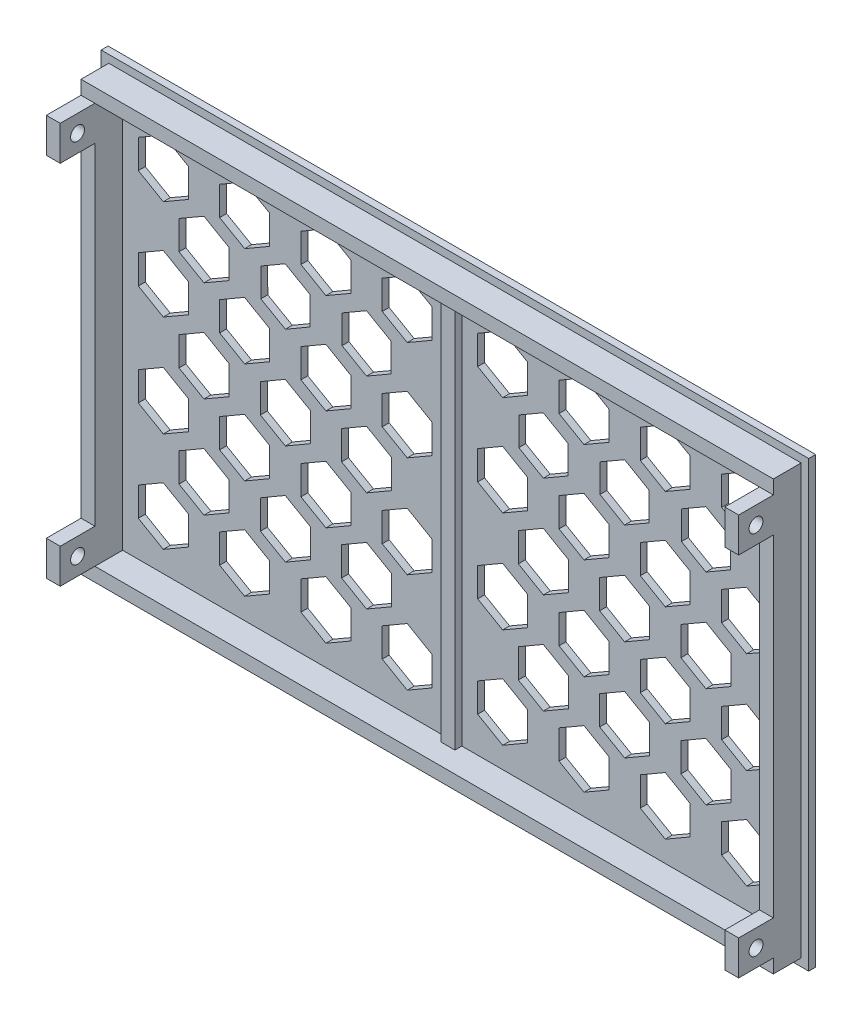
from build123d import *

# Parameters (mm, degrees)
SKETCH_1_W               = 102
SKETCH_1_H               = 64
EXTRUDE_1_DEPTH          = 1
SKETCH_1_4_W             = 99.8
SKETCH_1_4_H             = 2
SKETCH_1_4_W_2           = 2
SKETCH_1_4_H_2           = 47.8
EXTRUDE_3_DEPTH          = 5
SKETCH_1_5_W             = 2
SKETCH_1_5_H             = 5
EXTRUDE_4_DEPTH          = 10
SKETCH_1_7_W             = 2
SKETCH_1_7_H             = 57.8
EXTRUDE_5_DEPTH          = 2
CUT_EXTRUDE_3_DEPTH      = 1
CUT_EXTRUDE_3_DEPTH_BACK = 1
SKETCH_2_R               = 1
CUT_EXTRUDE_4_DEPTH      = 100


with BuildPart() as part:
    # Эскиз1 → Бобышка-Вытянуть1 (new body)
    with BuildSketch(Plane.XY):
        with Locations((9.976998146, -11.748794104)):
            Rectangle(SKETCH_1_W, SKETCH_1_H)
    extrude(amount=EXTRUDE_1_DEPTH)

    # Эскиз1<4> → Бобышка-Вытянуть3 (add)
    with BuildSketch(Plane.XY):
        with Locations((9.976998146, -41.648794104)):
            Rectangle(SKETCH_1_4_W, SKETCH_1_4_H)
        with Locations((-38.923001854, -11.748794104)):
            Rectangle(SKETCH_1_4_W_2, SKETCH_1_4_H_2)
        with Locations((58.876998146, -11.748794104)):
            Rectangle(SKETCH_1_4_W_2, SKETCH_1_4_H_2)
        with Locations((9.976998146, 18.151205896)):
            Rectangle(SKETCH_1_4_W, SKETCH_1_4_H)
    extrude(amount=EXTRUDE_3_DEPTH)

    # Эскиз1<5> → Бобышка-Вытянуть4 (add)
    with BuildSketch(Plane.XY):
        with Locations((-38.923001854, -38.148794104)):
            Rectangle(SKETCH_1_5_W, SKETCH_1_5_H)
        with Locations((58.876998146, -38.148794104)):
            Rectangle(SKETCH_1_5_W, SKETCH_1_5_H)
        with Locations((-38.923001854, 14.651205896)):
            Rectangle(SKETCH_1_5_W, SKETCH_1_5_H)
        with Locations((58.876998146, 14.651205896)):
            Rectangle(SKETCH_1_5_W, SKETCH_1_5_H)
    extrude(amount=EXTRUDE_4_DEPTH)

    # Эскиз1<7> → Бобышка-Вытянуть5 (add)
    with BuildSketch(Plane.XY):
        with Locations((9.976998146, -11.748794104)):
            Rectangle(SKETCH_1_7_W, SKETCH_1_7_H)
    extrude(amount=EXTRUDE_5_DEPTH)

    # Эскиз1<8> → Вырез-Вытянуть3 (cut, two sides: drawn at the far end of the back side and taken through both)
    with BuildSketch(Plane.XY.offset(-CUT_EXTRUDE_3_DEPTH_BACK)):
        Polygon((-35.663001854, 7.872744927), (-32.063001854, 5.794283958), (-28.463001854, 7.872744927), (-28.463001854, 12.029666866), (-32.063001854, 14.108127835), (-35.663001854, 12.029666866), align=None)
        Polygon((-22.603001854, 4.829666866), (-26.203001854, 6.908127835), (-29.803001854, 4.829666866), (-29.803001854, 0.672744927), (-26.203001854, -1.405716042), (-22.603001854, 0.672744927), align=None)
        Polygon((-16.743001854, 12.029666866), (-20.343001854, 14.108127835), (-23.943001854, 12.029666866), (-23.943001854, 7.872744927), (-20.343001854, 5.794283958), (-16.743001854, 7.872744927), align=None)
        Polygon((-5.023001854, 12.029666866), (-8.623001854, 14.108127835), (-12.223001854, 12.029666866), (-12.223001854, 7.872744927), (-8.623001854, 5.794283958), (-5.023001854, 7.872744927), align=None)
        Polygon((6.696998146, 12.029666866), (3.096998146, 14.108127835), (-0.503001854, 12.029666866), (-0.503001854, 7.872744927), (3.096998146, 5.794283958), (6.696998146, 7.872744927), align=None)
        Polygon((-10.942618947, 4.801020424), (-14.483001854, 6.833514443), (-18.013384761, 4.783699916), (-18.003384761, 0.701391369), (-14.463001854, -1.33110265), (-10.932618947, 0.718711877), align=None)
        Polygon((0.772381053, 4.79236017), (-2.763001854, 6.833514443), (-6.298384761, 4.79236017), (-6.298384761, 0.710051623), (-2.763001854, -1.33110265), (0.772381053, 0.710051623), align=None)
        Polygon((-28.463001854, -2.370333134), (-32.063001854, -0.291872165), (-35.663001854, -2.370333134), (-35.663001854, -6.527255073), (-32.063001854, -8.605716042), (-28.463001854, -6.527255073), align=None)
        Polygon((-28.463001854, -16.970333134), (-32.063001854, -14.891872165), (-35.663001854, -16.970333134), (-35.663001854, -21.127255073), (-32.063001854, -23.205716042), (-28.463001854, -21.127255073), align=None)
        Polygon((-28.463001854, -31.370333134), (-32.063001854, -29.291872165), (-35.663001854, -31.370333134), (-35.663001854, -35.527255073), (-32.063001854, -37.605716042), (-28.463001854, -35.527255073), align=None)
        Polygon((-16.743001854, -31.370333134), (-20.343001854, -29.291872165), (-23.943001854, -31.370333134), (-23.943001854, -35.527255073), (-20.343001854, -37.605716042), (-16.743001854, -35.527255073), align=None)
        Polygon((-5.023001854, -31.370333134), (-8.623001854, -29.291872165), (-12.223001854, -31.370333134), (-12.223001854, -35.527255073), (-8.623001854, -37.605716042), (-5.023001854, -35.527255073), align=None)
        Polygon((6.696998146, -31.370333134), (3.096998146, -29.291872165), (-0.503001854, -31.370333134), (-0.503001854, -35.527255073), (3.096998146, -37.605716042), (6.696998146, -35.527255073), align=None)
        Polygon((20.456998146, -31.370333134), (16.856998146, -29.291872165), (13.256998146, -31.370333134), (13.256998146, -35.527255073), (16.856998146, -37.605716042), (20.456998146, -35.527255073), align=None)
        Polygon((32.176998146, -31.370333134), (28.576998146, -29.291872165), (24.976998146, -31.370333134), (24.976998146, -35.527255073), (28.576998146, -37.605716042), (32.176998146, -35.527255073), align=None)
        Polygon((-16.743001854, -16.970333134), (-20.343001854, -14.891872165), (-23.943001854, -16.970333134), (-23.943001854, -21.127255073), (-20.343001854, -23.205716042), (-16.743001854, -21.127255073), align=None)
        Polygon((-16.743001854, -2.370333134), (-20.343001854, -0.291872165), (-23.943001854, -2.370333134), (-23.943001854, -6.527255073), (-20.343001854, -8.605716042), (-16.743001854, -6.527255073), align=None)
        Polygon((-5.023001854, -2.370333134), (-8.623001854, -0.291872165), (-12.223001854, -2.370333134), (-12.223001854, -6.527255073), (-8.623001854, -8.605716042), (-5.023001854, -6.527255073), align=None)
        Polygon((6.696998146, -2.370333134), (3.096998146, -0.291872165), (-0.503001854, -2.370333134), (-0.503001854, -6.527255073), (3.096998146, -8.605716042), (6.696998146, -6.527255073), align=None)
        Polygon((20.456998146, -2.370333134), (16.856998146, -0.291872165), (13.256998146, -2.370333134), (13.256998146, -6.527255073), (16.856998146, -8.605716042), (20.456998146, -6.527255073), align=None)
        Polygon((32.176998146, -2.370333134), (28.576998146, -0.291872165), (24.976998146, -2.370333134), (24.976998146, -6.527255073), (28.576998146, -8.605716042), (32.176998146, -6.527255073), align=None)
        Polygon((43.896998146, -2.370333134), (40.296998146, -0.291872165), (36.696998146, -2.370333134), (36.696998146, -6.527255073), (40.296998146, -8.605716042), (43.896998146, -6.527255073), align=None)
        Polygon((55.616998146, -2.370333134), (52.016998146, -0.291872165), (48.416998146, -2.370333134), (48.416998146, -6.527255073), (52.016998146, -8.605716042), (55.616998146, -6.527255073), align=None)
        Polygon((43.896998146, -31.370333134), (40.296998146, -29.291872165), (36.696998146, -31.370333134), (36.696998146, -35.527255073), (40.296998146, -37.605716042), (43.896998146, -35.527255073), align=None)
        Polygon((55.616998146, -31.370333134), (52.016998146, -29.291872165), (48.416998146, -31.370333134), (48.416998146, -35.527255073), (52.016998146, -37.605716042), (55.616998146, -35.527255073), align=None)
        Polygon((-5.023001854, -16.970333134), (-8.623001854, -14.891872165), (-12.223001854, -16.970333134), (-12.223001854, -21.127255073), (-8.623001854, -23.205716042), (-5.023001854, -21.127255073), align=None)
        Polygon((6.696998146, -16.970333134), (3.096998146, -14.891872165), (-0.503001854, -16.970333134), (-0.503001854, -21.127255073), (3.096998146, -23.205716042), (6.696998146, -21.127255073), align=None)
        Polygon((20.456998146, -16.970333134), (16.856998146, -14.891872165), (13.256998146, -16.970333134), (13.256998146, -21.127255073), (16.856998146, -23.205716042), (20.456998146, -21.127255073), align=None)
        Polygon((32.176998146, -16.970333134), (28.576998146, -14.891872165), (24.976998146, -16.970333134), (24.976998146, -21.127255073), (28.576998146, -23.205716042), (32.176998146, -21.127255073), align=None)
        Polygon((43.896998146, -16.970333134), (40.296998146, -14.891872165), (36.696998146, -16.970333134), (36.696998146, -21.127255073), (40.296998146, -23.205716042), (43.896998146, -21.127255073), align=None)
        Polygon((55.616998146, -16.970333134), (52.016998146, -14.891872165), (48.416998146, -16.970333134), (48.416998146, -21.127255073), (52.016998146, -23.205716042), (55.616998146, -21.127255073), align=None)
        Polygon((26.252381053, 4.79236017), (22.716998146, 6.833514443), (19.181615239, 4.79236017), (19.181615239, 0.710051623), (22.716998146, -1.33110265), (26.252381053, 0.710051623), align=None)
        Polygon((37.967381053, 4.783699916), (34.436998146, 6.833514443), (30.896615239, 4.801020424), (30.886615239, 0.718711877), (34.416998146, -1.33110265), (37.957381053, 0.701391369), align=None)
        Polygon((49.692381053, 4.79236017), (46.156998146, 6.833514443), (42.621615239, 4.79236017), (42.621615239, 0.710051623), (46.156998146, -1.33110265), (49.692381053, 0.710051623), align=None)
        Polygon((20.456998146, 12.029666866), (16.856998146, 14.108127835), (13.256998146, 12.029666866), (13.256998146, 7.872744927), (16.856998146, 5.794283958), (20.456998146, 7.872744927), align=None)
        Polygon((32.176998146, 12.029666866), (28.576998146, 14.108127835), (24.976998146, 12.029666866), (24.976998146, 7.872744927), (28.576998146, 5.794283958), (32.176998146, 7.872744927), align=None)
        Polygon((43.896998146, 12.029666866), (40.296998146, 14.108127835), (36.696998146, 12.029666866), (36.696998146, 7.872744927), (40.296998146, 5.794283958), (43.896998146, 7.872744927), align=None)
        Polygon((55.616998146, 12.029666866), (52.016998146, 14.108127835), (48.416998146, 12.029666866), (48.416998146, 7.872744927), (52.016998146, 5.794283958), (55.616998146, 7.872744927), align=None)
        Polygon((-22.603001854, -9.670333134), (-26.203001854, -7.591872165), (-29.803001854, -9.670333134), (-29.803001854, -13.827255073), (-26.203001854, -15.905716042), (-22.603001854, -13.827255073), align=None)
        Polygon((-22.603001854, -24.170333134), (-26.203001854, -22.091872165), (-29.803001854, -24.170333134), (-29.803001854, -28.327255073), (-26.203001854, -30.405716042), (-22.603001854, -28.327255073), align=None)
        Polygon((-10.878001854, -9.66167288), (-14.483001854, -7.591872165), (-18.078001854, -9.678993389), (-18.068001854, -13.835915327), (-14.463001854, -15.905716042), (-10.868001854, -13.818594819), align=None)
        Polygon((0.836998146, -9.670333134), (-2.763001854, -7.591872165), (-6.363001854, -9.670333134), (-6.363001854, -13.827255073), (-2.763001854, -15.905716042), (0.836998146, -13.827255073), align=None)
        Polygon((26.316998146, -9.670333134), (22.716998146, -7.591872165), (19.116998146, -9.670333134), (19.116998146, -13.827255073), (22.716998146, -15.905716042), (26.316998146, -13.827255073), align=None)
        Polygon((38.036998146, -9.670333134), (34.436998146, -7.591872165), (30.836998146, -9.670333134), (30.836998146, -13.827255073), (34.436998146, -15.905716042), (38.036998146, -13.827255073), align=None)
        Polygon((49.756998146, -9.670333134), (46.156998146, -7.591872165), (42.556998146, -9.670333134), (42.556998146, -13.827255073), (46.156998146, -15.905716042), (49.756998146, -13.827255073), align=None)
        Polygon((49.756998146, -24.170333134), (46.156998146, -22.091872165), (42.556998146, -24.170333134), (42.556998146, -28.327255073), (46.156998146, -30.405716042), (49.756998146, -28.327255073), align=None)
        Polygon((38.036998146, -24.170333134), (34.436998146, -22.091872165), (30.836998146, -24.170333134), (30.836998146, -28.327255073), (34.436998146, -30.405716042), (38.036998146, -28.327255073), align=None)
        Polygon((26.316998146, -24.170333134), (22.716998146, -22.091872165), (19.116998146, -24.170333134), (19.116998146, -28.327255073), (22.716998146, -30.405716042), (26.316998146, -28.327255073), align=None)
        Polygon((-10.878001854, -24.16167288), (-14.483001854, -22.091872165), (-18.078001854, -24.178993389), (-18.068001854, -28.335915327), (-14.463001854, -30.405716042), (-10.868001854, -28.318594819), align=None)
        Polygon((0.836998146, -24.170333134), (-2.763001854, -22.091872165), (-6.363001854, -24.170333134), (-6.363001854, -28.327255073), (-2.763001854, -30.405716042), (0.836998146, -28.327255073), align=None)
    extrude(amount=CUT_EXTRUDE_3_DEPTH + CUT_EXTRUDE_3_DEPTH_BACK, mode=Mode.SUBTRACT)

    # Эскиз2 → Вырез-Вытянуть4 (cut)
    with BuildSketch(Plane(origin=(59.876998146, 0, 0), x_dir=(0, 0, -1), z_dir=(1, 0, 0))):
        with Locations((-7.5, 14.651205896)):
            Circle(SKETCH_2_R)
        with Locations((-7.5, -38.148794104)):
            Circle(SKETCH_2_R)
    extrude(amount=-CUT_EXTRUDE_4_DEPTH, mode=Mode.SUBTRACT)


solid = part.part
